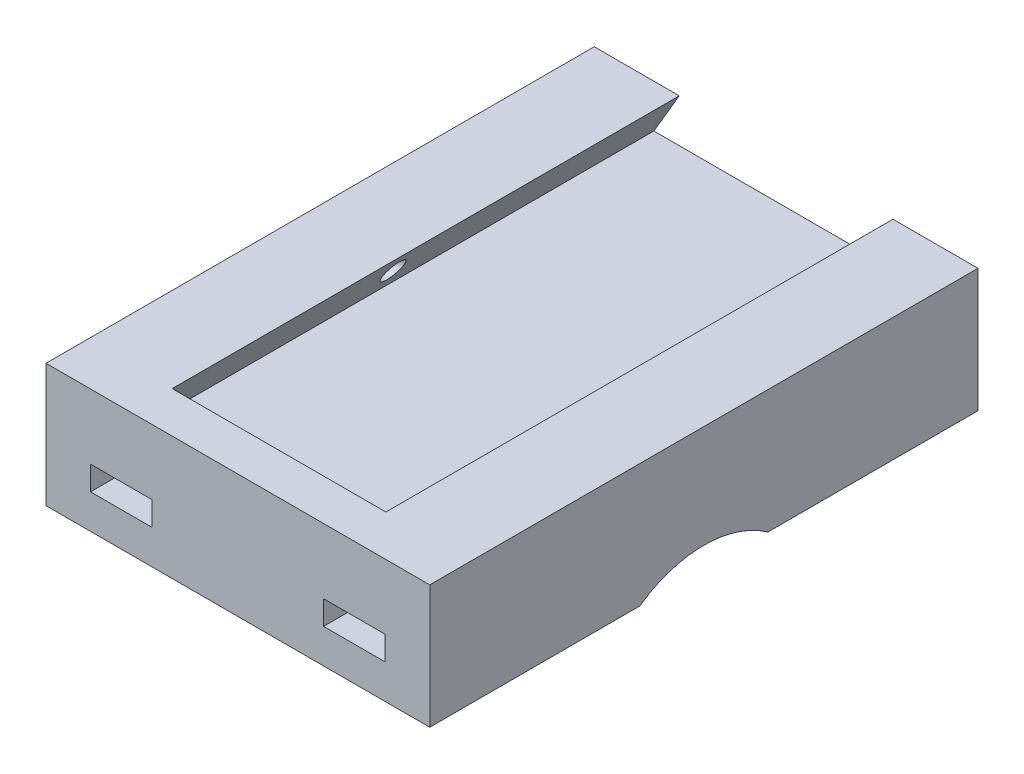
from build123d import *

# Parameters (mm, degrees)
SKETCH1_W                   = 56
SKETCH1_H                   = 18
BRACKET_BLOCK_DEPTH         = 40
DOVETAIL_CHANNEL_DEPTH      = 34
DOVETAIL_CHANNEL_DEPTH_BACK = 41
TUBE_SADDLE_DEPTH           = 53.038447325
TUBE_SADDLE_DEPTH_BACK      = 53.038447325
SKETCH3_R                   = 16
STRAP_SLOTS_DEPTH           = 53.038447325
STRAP_SLOTS_DEPTH_BACK      = 53.038447325
SKETCH4_W                   = 9
SKETCH4_H                   = 3.5
SKETCH5_R                   = 1.65
LOCK_SCREW_HOLE_DEPTH       = 53.038447325


with BuildPart() as part:
    # Sketch1 → Bracket Block (new, symmetric)
    with BuildSketch(Plane.XY):
        with Locations((0, 9)):
            Rectangle(SKETCH1_W, SKETCH1_H)
    extrude(amount=BRACKET_BLOCK_DEPTH, both=True)

    # Sketch2 → Dovetail Channel (cut, two sides: drawn at the far end of the back side and taken through both)
    with BuildSketch(Plane.XY.offset(-DOVETAIL_CHANNEL_DEPTH_BACK)):
        Polygon((-15.3, 18.5), (15.3, 18.5), (19.3, 11.7), (-19.3, 11.7), align=None)
    extrude(amount=DOVETAIL_CHANNEL_DEPTH + DOVETAIL_CHANNEL_DEPTH_BACK, mode=Mode.SUBTRACT)

    # Sketch3 → Tube Saddle (cut, two sides: drawn at the far end of the back side and taken through both)
    with BuildSketch(Plane(origin=(0, 0, 0), x_dir=(0, 0, -1), z_dir=(1, 0, 0)).offset(-TUBE_SADDLE_DEPTH_BACK)):
        with Locations((0, -13)):
            Circle(SKETCH3_R)
    extrude(amount=TUBE_SADDLE_DEPTH + TUBE_SADDLE_DEPTH_BACK, mode=Mode.SUBTRACT)

    # Sketch4 → Strap Slots (cut, two sides: drawn at the far end of the back side and taken through both)
    with BuildSketch(Plane.XY.offset(-STRAP_SLOTS_DEPTH_BACK)):
        with Locations((-17, 6.75)):
            Rectangle(SKETCH4_W, SKETCH4_H)
        with Locations((17, 6.75)):
            Rectangle(SKETCH4_W, SKETCH4_H)
    extrude(amount=STRAP_SLOTS_DEPTH + STRAP_SLOTS_DEPTH_BACK, mode=Mode.SUBTRACT)

    # Sketch5 → Lock Screw Hole (cut, through all)
    with BuildSketch(Plane(origin=(0, 0, 0), x_dir=(0, 0, -1), z_dir=(1, 0, 0))):
        with Locations((0, 15)):
            Circle(SKETCH5_R)
    extrude(amount=-LOCK_SCREW_HOLE_DEPTH, mode=Mode.SUBTRACT)


solid = part.part
